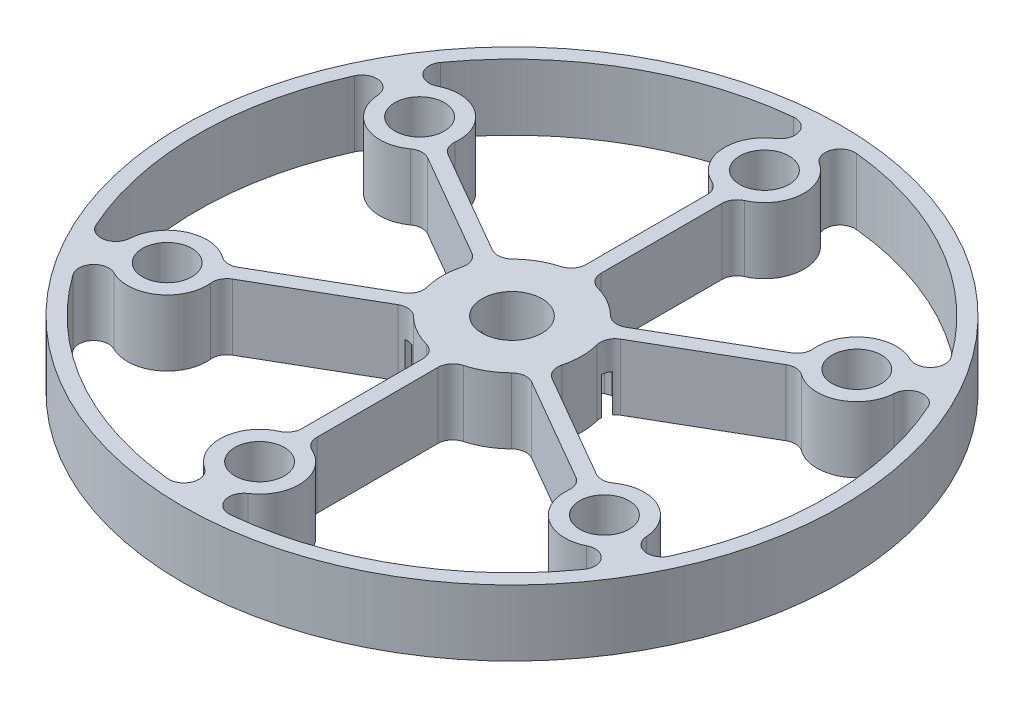
from build123d import *

# Parameters (mm, degrees)
SKETCH1_R         = 22
BASE_SHAPE_DEPTH  = 4.4
BASE_CUT_REACH    = 33.422
SKETCH4_R         = 2
MILLING_FILLETS_R = 1
INSERT_CUTS_REACH = 33.422
SKETCH12_R        = 1.65
PIN_CUT_DEPTH     = 2.5


with BuildPart() as part:
    # Sketch1 → Base shape (new body)
    with BuildSketch(Plane(origin=(0, 0, 0), x_dir=(1, 0, 0), z_dir=(0, 1, 0))):
        Circle(SKETCH1_R)
    extrude(amount=BASE_SHAPE_DEPTH)

    # Sketch4 → Base cut (cut, up to next)
    with BuildSketch(Plane(origin=(0, 4.4, 0), x_dir=(1, 0, 0), z_dir=(0, 1, 0)), mode=Mode.PRIVATE) as base_cut_sk1:
        with BuildLine():
            Line((-0.5, 4.623040125), (-0.5, 14.247597264))
            ThreePointArc((-0.5, 14.247597264), (-2.599217903, 16.333699419), (-1.456663106, 19.063737246))
            ThreePointArc((-1.456663106, 19.063737246), (-1.064005646, 20.23376217), (-2.106664753, 20.894065273))
            ThreePointArc((-2.106664753, 20.894065273), (-10.500000081, 18.186533433), (-17.041459047, 12.271457678))
            ThreePointArc((-17.041459047, 12.271457678), (-16.990949169, 11.038336932), (-15.781349192, 10.793375879))
            ThreePointArc((-15.781349192, 10.793375879), (-12.845789682, 10.417838443), (-12.088781174, 7.556811334))
            Line((-12.088781174, 7.556811334), (-3.753670191, 2.744532765))
            ThreePointArc((-3.753670191, 2.744532765), (-2.325, 4.027018128), (-0.5, 4.623040125))
        make_face()
    base_cut_tool1 = extrude(base_cut_sk1.sketch, amount=-BASE_CUT_REACH, mode=Mode.PRIVATE) & part.part
    # Sketch4 → Base cut (cut, up to next)
    with BuildSketch(Plane(origin=(0, 4.4, 0), x_dir=(1, 0, 0), z_dir=(0, 1, 0)), mode=Mode.PRIVATE) as base_cut_sk2:
        with BuildLine():
            Line((0.5, 14.247597264), (0.5, 4.623040125))
            ThreePointArc((0.5, 4.623040125), (2.325, 4.027018128), (3.753670191, 2.744532765))
            Line((3.753670191, 2.744532765), (12.088781174, 7.556811334))
            ThreePointArc((12.088781174, 7.556811334), (12.845789714, 10.417838471), (15.781349267, 10.793375841))
            ThreePointArc((15.781349267, 10.793375841), (16.990949176, 11.03833694), (17.041459084, 12.271457627))
            ThreePointArc((17.041459084, 12.271457627), (10.500000121, 18.186533409), (2.106664783, 20.89406527))
            ThreePointArc((2.106664783, 20.89406527), (1.064005647, 20.233762173), (1.456663125, 19.063737234))
            ThreePointArc((1.456663125, 19.063737234), (2.599217901, 16.333699407), (0.5, 14.247597264))
        make_face()
    base_cut_tool2 = extrude(base_cut_sk2.sketch, amount=-BASE_CUT_REACH, mode=Mode.PRIVATE) & part.part
    # Sketch4 → Base cut (cut, up to next)
    with BuildSketch(Plane(origin=(0, 4.4, 0), x_dir=(1, 0, 0), z_dir=(0, 1, 0)), mode=Mode.PRIVATE) as base_cut_sk3:
        with BuildLine():
            ThreePointArc((-4.253670191, -1.878507361), (-4.65, 0), (-4.253670191, 1.878507361))
            Line((-4.253670191, 1.878507361), (-12.588781174, 6.69078593))
            ThreePointArc((-12.588781174, 6.69078593), (-15.445007591, 5.915860977), (-17.2380123, 8.27036138))
            ThreePointArc((-17.2380123, 8.27036138), (-18.054954849, 9.19542516), (-19.148123664, 8.622607504))
            ThreePointArc((-19.148123664, 8.622607504), (-21, 0), (-19.148123664, -8.622607504))
            ThreePointArc((-19.148123664, -8.622607504), (-18.054954849, -9.19542516), (-17.2380123, -8.27036138))
            ThreePointArc((-17.2380123, -8.27036138), (-15.445007591, -5.915860977), (-12.588781174, -6.69078593))
            Line((-12.588781174, -6.69078593), (-4.253670191, -1.878507361))
        make_face()
    base_cut_tool3 = extrude(base_cut_sk3.sketch, amount=-BASE_CUT_REACH, mode=Mode.PRIVATE) & part.part
    # Sketch4 → Base cut (cut, up to next)
    with BuildSketch(Plane(origin=(0, 4.4, 0), x_dir=(1, 0, 0), z_dir=(0, 1, 0)), mode=Mode.PRIVATE) as base_cut_sk4:
        with BuildLine():
            Line((12.588781174, 6.69078593), (4.253670191, 1.878507361))
            ThreePointArc((4.253670191, 1.878507361), (4.65, 0), (4.253670191, -1.878507361))
            Line((4.253670191, -1.878507361), (12.588781174, -6.69078593))
            ThreePointArc((12.588781174, -6.69078593), (15.44500764, -5.915860993), (17.238012306, -8.270361482))
            ThreePointArc((17.238012306, -8.270361482), (18.054954899, -9.19542517), (19.148123664, -8.622607504))
            ThreePointArc((19.148123664, -8.622607504), (21, -5.9e-08), (19.148123712, 8.622607396))
            ThreePointArc((19.148123712, 8.622607396), (18.054954907, 9.195425171), (17.2380123, 8.27036138))
            ThreePointArc((17.2380123, 8.27036138), (15.445007591, 5.915860977), (12.588781174, 6.69078593))
        make_face()
    base_cut_tool4 = extrude(base_cut_sk4.sketch, amount=-BASE_CUT_REACH, mode=Mode.PRIVATE) & part.part
    # Sketch4 → Base cut (cut, up to next)
    with BuildSketch(Plane(origin=(0, 4.4, 0), x_dir=(1, 0, 0), z_dir=(0, 1, 0)), mode=Mode.PRIVATE) as base_cut_sk5:
        with BuildLine():
            ThreePointArc((-0.5, -4.623040125), (-2.325, -4.027018128), (-3.753670191, -2.744532765))
            Line((-3.753670191, -2.744532765), (-12.088781174, -7.556811334))
            ThreePointArc((-12.088781174, -7.556811334), (-12.845789662, -10.417838426), (-15.781349145, -10.793375902))
            ThreePointArc((-15.781349145, -10.793375902), (-16.99094917, -11.038336934), (-17.041459014, -12.271457724))
            ThreePointArc((-17.041459014, -12.271457724), (-10.500000007, -18.186533475), (-2.10666464, -20.894065284))
            ThreePointArc((-2.10666464, -20.894065284), (-1.064005631, -20.233762127), (-1.456663086, -19.063737259))
            ThreePointArc((-1.456663086, -19.063737259), (-2.599217906, -16.33369943), (-0.5, -14.247597264))
            Line((-0.5, -14.247597264), (-0.5, -4.623040125))
        make_face()
    base_cut_tool5 = extrude(base_cut_sk5.sketch, amount=-BASE_CUT_REACH, mode=Mode.PRIVATE) & part.part
    # Sketch4 → Base cut (cut, up to next)
    with BuildSketch(Plane(origin=(0, 4.4, 0), x_dir=(1, 0, 0), z_dir=(0, 1, 0)), mode=Mode.PRIVATE) as base_cut_sk6:
        with BuildLine():
            Line((12.088781174, -7.556811334), (3.753670191, -2.744532765))
            ThreePointArc((3.753670191, -2.744532765), (2.325, -4.027018128), (0.5, -4.623040125))
            Line((0.5, -4.623040125), (0.5, -14.247597264))
            ThreePointArc((0.5, -14.247597264), (2.599217906, -16.33369943), (1.456663086, -19.063737259))
            ThreePointArc((1.456663086, -19.063737259), (1.064005629, -20.23376212), (2.106664626, -20.894065285))
            ThreePointArc((2.106664626, -20.894065285), (10.500000013, -18.186533472), (17.04145903, -12.271457701))
            ThreePointArc((17.04145903, -12.271457701), (16.990949199, -11.038336967), (15.781349249, -10.79337585))
            ThreePointArc((15.781349249, -10.79337585), (12.845789706, -10.417838464), (12.088781174, -7.556811334))
        make_face()
    base_cut_tool6 = extrude(base_cut_sk6.sketch, amount=-BASE_CUT_REACH, mode=Mode.PRIVATE) & part.part
    # Sketch4 → Base cut (cut, up to next)
    with BuildSketch(Plane(origin=(0, 4.4, 0), x_dir=(1, 0, 0), z_dir=(0, 1, 0)), mode=Mode.PRIVATE) as base_cut_sk7:
        Circle(SKETCH4_R)
    base_cut_tool7 = extrude(base_cut_sk7.sketch, amount=-BASE_CUT_REACH, mode=Mode.PRIVATE) & part.part
    add(base_cut_tool1.solids().sort_by_distance((-6.983603, 4.4, -12.095955))[0], mode=Mode.SUBTRACT)
    add(base_cut_tool2.solids().sort_by_distance((6.983603, 4.4, -12.095955))[0], mode=Mode.SUBTRACT)
    add(base_cut_tool3.solids().sort_by_distance((-13.967206, 4.4, 0))[0], mode=Mode.SUBTRACT)
    add(base_cut_tool4.solids().sort_by_distance((13.967206, 4.4, 0))[0], mode=Mode.SUBTRACT)
    add(base_cut_tool5.solids().sort_by_distance((-6.983603, 4.4, 12.095955))[0], mode=Mode.SUBTRACT)
    add(base_cut_tool6.solids().sort_by_distance((6.983603, 4.4, 12.095955))[0], mode=Mode.SUBTRACT)
    add(base_cut_tool7.solids().sort_by_distance((0, 4.4, 0))[0], mode=Mode.SUBTRACT)

    # Milling fillets
    milling_fillets_edges = [part.edges().sort_by_distance(p)[0] for p in [
        (12.088781174, 2.2, 7.556811334),
        (0.5, 2.2, 4.623040125),
        (12.588781174, 2.2, -6.69078593),
        (-0.5, 2.2, -4.623040125),
        (12.088781174, 2.2, -7.556811334),
        (0.5, 2.2, -4.623040125),
        (4.253670191, 2.2, 1.878507361),
        (0.5, 2.2, -14.247597264),
        (-12.088781174, 2.2, 7.556811334),
        (0.5, 2.2, 14.247597264),
        (3.753670191, 2.2, 2.744532765),
        (-0.5, 2.2, 4.623040125),
        (-0.5, 2.2, -14.247597264),
        (-0.5, 2.2, 14.247597264),
        (12.588781174, 2.2, 6.69078593),
        (3.753670191, 2.2, -2.744532765),
        (-4.253670191, 2.2, 1.878507361),
        (-12.588781174, 2.2, 6.69078593),
        (-3.753670191, 2.2, -2.744532765),
        (-12.088781174, 2.2, -7.556811334),
        (-12.588781174, 2.2, -6.69078593),
        (-4.253670191, 2.2, -1.878507361),
        (4.253670191, 2.2, -1.878507361),
        (-3.753670191, 2.2, 2.744532765),
    ]]
    fillet(milling_fillets_edges, radius=MILLING_FILLETS_R)

    # Sketch12 → Insert cuts (cut, up to next)
    with BuildSketch(Plane(origin=(0, 4.4, 0), x_dir=(1, 0, 0), z_dir=(0, 1, 0)), mode=Mode.PRIVATE) as insert_cuts_sk1:
        with Locations((0, 16.85)):
            Circle(SKETCH12_R)
    insert_cuts_tool1 = extrude(insert_cuts_sk1.sketch, amount=-INSERT_CUTS_REACH, mode=Mode.PRIVATE) & part.part
    # Sketch12 → Insert cuts (cut, up to next)
    with BuildSketch(Plane(origin=(0, 4.4, 0), x_dir=(1, 0, 0), z_dir=(0, 1, 0)), mode=Mode.PRIVATE) as insert_cuts_sk2:
        with Locations((14.592528054, 8.425)):
            Circle(SKETCH12_R)
    insert_cuts_tool2 = extrude(insert_cuts_sk2.sketch, amount=-INSERT_CUTS_REACH, mode=Mode.PRIVATE) & part.part
    # Sketch12 → Insert cuts (cut, up to next)
    with BuildSketch(Plane(origin=(0, 4.4, 0), x_dir=(1, 0, 0), z_dir=(0, 1, 0)), mode=Mode.PRIVATE) as insert_cuts_sk3:
        with Locations((14.592528054, -8.425)):
            Circle(SKETCH12_R)
    insert_cuts_tool3 = extrude(insert_cuts_sk3.sketch, amount=-INSERT_CUTS_REACH, mode=Mode.PRIVATE) & part.part
    # Sketch12 → Insert cuts (cut, up to next)
    with BuildSketch(Plane(origin=(0, 4.4, 0), x_dir=(1, 0, 0), z_dir=(0, 1, 0)), mode=Mode.PRIVATE) as insert_cuts_sk4:
        with Locations((0, -16.85)):
            Circle(SKETCH12_R)
    insert_cuts_tool4 = extrude(insert_cuts_sk4.sketch, amount=-INSERT_CUTS_REACH, mode=Mode.PRIVATE) & part.part
    # Sketch12 → Insert cuts (cut, up to next)
    with BuildSketch(Plane(origin=(0, 4.4, 0), x_dir=(1, 0, 0), z_dir=(0, 1, 0)), mode=Mode.PRIVATE) as insert_cuts_sk5:
        with Locations((-14.592528054, -8.425)):
            Circle(SKETCH12_R)
    insert_cuts_tool5 = extrude(insert_cuts_sk5.sketch, amount=-INSERT_CUTS_REACH, mode=Mode.PRIVATE) & part.part
    # Sketch12 → Insert cuts (cut, up to next)
    with BuildSketch(Plane(origin=(0, 4.4, 0), x_dir=(1, 0, 0), z_dir=(0, 1, 0)), mode=Mode.PRIVATE) as insert_cuts_sk6:
        with Locations((-14.592528054, 8.425)):
            Circle(SKETCH12_R)
    insert_cuts_tool6 = extrude(insert_cuts_sk6.sketch, amount=-INSERT_CUTS_REACH, mode=Mode.PRIVATE) & part.part
    add(insert_cuts_tool1.solids().sort_by_distance((0, 4.4, -16.85))[0], mode=Mode.SUBTRACT)
    add(insert_cuts_tool2.solids().sort_by_distance((14.592528, 4.4, -8.425))[0], mode=Mode.SUBTRACT)
    add(insert_cuts_tool3.solids().sort_by_distance((14.592528, 4.4, 8.425))[0], mode=Mode.SUBTRACT)
    add(insert_cuts_tool4.solids().sort_by_distance((0, 4.4, 16.85))[0], mode=Mode.SUBTRACT)
    add(insert_cuts_tool5.solids().sort_by_distance((-14.592528, 4.4, 8.425))[0], mode=Mode.SUBTRACT)
    add(insert_cuts_tool6.solids().sort_by_distance((-14.592528, 4.4, -8.425))[0], mode=Mode.SUBTRACT)

    # Sketch3 → Pin cut (cut)
    with BuildSketch(Plane.XZ):
        with BuildLine():
            Line((-3.180607966, 2.991025404), (4.180607966, -1.258974596))
            ThreePointArc((4.180607966, -1.258974596), (4.54663337, -2.625), (3.180607966, -2.991025404))
            Line((3.180607966, -2.991025404), (-4.180607966, 1.258974596))
            ThreePointArc((-4.180607966, 1.258974596), (-4.54663337, 2.625), (-3.180607966, 2.991025404))
        make_face()
    extrude(amount=-PIN_CUT_DEPTH, mode=Mode.SUBTRACT)


solid = part.part
